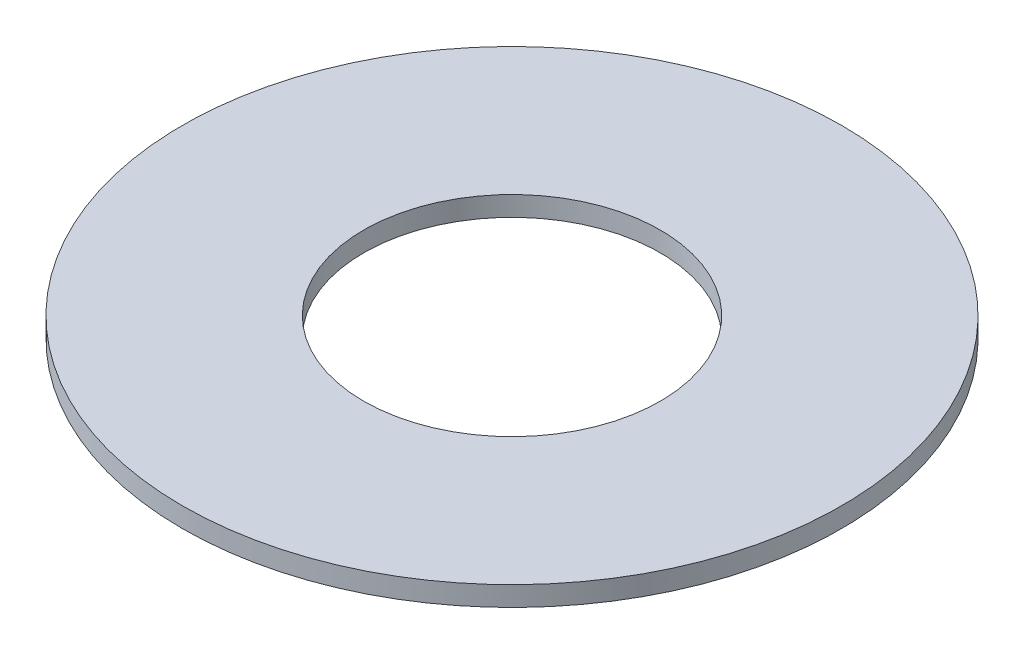
from build123d import *

# Parameters (mm, degrees)
SKETCH1_R           = 100
BOSS_EXTRUDE1_DEPTH = 6
SKETCH2_R           = 45
CUT_EXTRUDE1_DEPTH  = 142.548578234


with BuildPart() as part:
    # Sketch1 → Boss-Extrude1 (new body)
    with BuildSketch(Plane(origin=(0, 0, 0), x_dir=(1, 0, 0), z_dir=(0, 1, 0))):
        Circle(SKETCH1_R)
    extrude(amount=BOSS_EXTRUDE1_DEPTH)

    # Sketch2 → Cut-Extrude1 (cut, through all)
    with BuildSketch(Plane(origin=(0, 0, 0), x_dir=(1, 0, 0), z_dir=(0, 1, 0))):
        Circle(SKETCH2_R)
    extrude(amount=CUT_EXTRUDE1_DEPTH, mode=Mode.SUBTRACT)


solid = part.part
